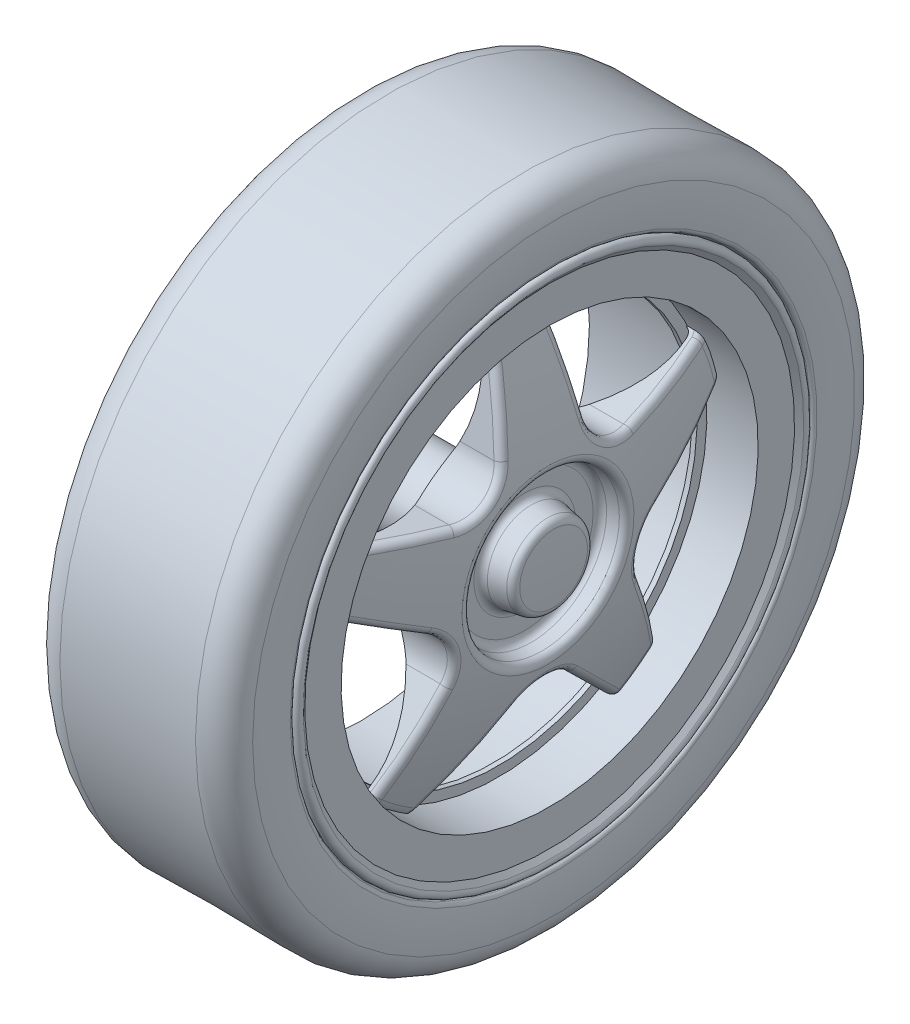
from build123d import *

# Parameters (mm, degrees)
CORTAR_EXTRUIR1_START = 28.999999999999996
CORTAR_EXTRUIR1_DEPTH = 28.999999999999996
MATRIZC1_COUNT        = 5
REDONDEO1_R           = 0.75
REDONDEO2_R           = 0.75
CORTAR_EXTRUIR2_DEPTH = 10


# Read off the part's stored shape, not the designer's step: Cortar-Revolución4
with BuildPart() as part:
    # Croquis1 → Revolución1 (revolve)
    with BuildSketch(Plane.XY):
        with BuildLine():
            Line((2.5, 24.999999999999996), (0.7352941176470583, 25.941176470588232))
            ThreePointArc((0.7352941176470585, 25.941176470588232), (0.12020814131487328, 25.825204772530324), (0.100301875811656, 25.199597920246344))
            Line((0.10030187581165524, 25.199597920246344), (0.5, 24.667782059947733))
            Line((0.5, 24.667782059947733), (0.5000000000000004, 20.999999999999996))
            Line((0.5000000000000004, 20.999999999999996), (13.83221794005226, 20.999999999999996))
            Line((13.83221794005226, 20.999999999999996), (15.83221794005226, 20.999999999999996))
            Line((15.83221794005226, 20.999999999999996), (19.5, 20.999999999999996))
            Line((19.5, 20.999999999999996), (19.5, 24.667782059947736))
            Line((19.5, 24.667782059947736), (19.899698124188344, 25.19959792024635))
            ThreePointArc((19.899698124188347, 25.19959792024635), (19.879791858685124, 25.825204772530324), (19.264705882352946, 25.941176470588236))
            Line((19.264705882352946, 25.941176470588236), (17.499999999999996, 25))
            Line((17.499999999999996, 25), (2.5, 24.999999999999996))
        make_face()
    revolve(axis=Axis((20, 0, 0), (-1, -1.2e-16, 0)))


with BuildPart() as body_2:
    # Croquis1<3> → Revolución2 (revolve)
    with BuildSketch(Plane.XY):
        with BuildLine():
            ThreePointArc((15.229709414249836, 20.044993192200682), (14.678536500553854, 20.73844454625571), (13.83221794005226, 20.999999999999996))
            Line((13.83221794005226, 20.999999999999996), (15.83221794005226, 20.999999999999996))
            ThreePointArc((15.83221794005226, 20.999999999999996), (16.01691722525036, 20.715355517227323), (16.161370397048206, 20.408321987001138))
            ThreePointArc((16.161370397048206, 20.408321987001138), (18.159269913999402, 14.261864726586808), (19.437899090853012, 7.926594664305913))
            Line((19.437899090853012, 7.926594664305913), (17.000000000000004, 7.5))
            Line((17.000000000000004, 7.5), (16.999999999999996, 4.500000000000001))
            Line((16.999999999999996, 4.500000000000001), (19.857395198343077, 4))
            ThreePointArc((19.857395198343077, 4), (19.96433747853814, 2.0012706044820376), (20, 0))
            Line((20, 0), (-4.999999999999995, -3.06e-15))
            Line((-4.999999999999995, -3.06e-15), (-4.999999999999994, 4))
            Line((-4.999999999999994, 4), (7.41803141324657, 6.172963582434665))
            ThreePointArc((7.41803141324657, 6.172963582434665), (14.609153979008614, 11.25895513363789), (15.229709414249836, 20.044993192200682))
        make_face()
    revolve(axis=Axis((20, 0, 0), (-1, -1.2e-16, 0)))

    # Croquis2 → Cortar-Extruir1 (cut)
    with BuildSketch(Plane(origin=(0, 0, 0), x_dir=(0, 0, -1), z_dir=(1, 0, 0)).offset(CORTAR_EXTRUIR1_START)):
        with BuildLine():
            ThreePointArc((-19.032482471529132, 8.874942871418174), (-12.343490298141932, 16.989356881873892), (-2.5592117207636766, 20.843474647196086))
            Line((-2.5592117207636766, 20.843474647196086), (-4.238740146298038, 10.618509398268122))
            ThreePointArc((-4.238740146298038, 10.618509398268122), (-5.834705949164168, 8.030783779695161), (-8.788959816618782, 7.312581296013566))
            Line((-8.788959816618782, 7.312581296013566), (-19.032482471529132, 8.874942871418174))
        make_face()
    cortar_extruir1 = extrude(amount=-CORTAR_EXTRUIR1_DEPTH, mode=Mode.SUBTRACT)

    # MatrizC1: Cortar-Extruir1 ×5 about axis
    matrizc1_axis = Axis((0, 1.5e-15, -3.8e-16), (1, 0, 0))
    for i in range(1, MATRIZC1_COUNT):
        add(cortar_extruir1.rotate(matrizc1_axis, i * 360 / MATRIZC1_COUNT), mode=Mode.SUBTRACT)


with BuildPart() as cortar_revoluci_n1_tool:
    # Croquis3 → Cortar-Revolución1 (revolve)
    with BuildSketch(Plane.XY):
        Polygon((14.332217940052262, 19.499999999999996), (14.332217940052264, 22.499999999999993), (14.332217940052264, 22.999999999999993), (13.83221794005226, 22.999999999999993), (13.83221794005226, 20.999999999999996), (13.83221794005226, 19.499999999999996), align=None)
        Polygon((13.83221794005226, 20.999999999999996), (13.83221794005226, 22.999999999999993), (-1.1677820599477382, 22.999999999999986), (-1.1677820599477386, 20.999999999999982), align=None)
    revolve(axis=Axis((7.418031413246568, -1.54e-15, 0), (-1, -1.2e-16, 0)))


with BuildPart() as part_1:
    add(part.part)

    # Cortar-Revolución1: cut by cortar_revoluci_n1_tool
    add(cortar_revoluci_n1_tool.part, mode=Mode.SUBTRACT)

    # Croquis4 → Revolución3 (revolve)
    with BuildSketch(Plane.XY):
        with BuildLine():
            Line((14.332217940052264, 22.999999999999993), (13.832217940052262, 22.999999999999993))
            Line((13.832217940052262, 22.999999999999993), (12.332217940052265, 22.999999999999996))
            ThreePointArc((12.332217940052265, 22.999999999999996), (13.392878111832086, 22.56066017177982), (13.832217940052262, 21.499999999999996))
            Line((13.832217940052262, 21.499999999999996), (13.832217940052262, 19.999999999999996))
            Line((13.832217940052262, 19.999999999999996), (14.332217940052264, 19.999999999999996))
            Line((14.332217940052264, 19.999999999999996), (14.332217940052264, 22.999999999999993))
        make_face()
    revolve(axis=Axis((7.418031413246568, -1.54e-15, 0), (-1, -1.2e-16, 0)))


with BuildPart() as body_2_1:
    add(body_2.part)

    # Cortar-Revolución1: cut by cortar_revoluci_n1_tool
    add(cortar_revoluci_n1_tool.part, mode=Mode.SUBTRACT)

    # Redondeo1
    redondeo1_edges = [body_2_1.edges().sort_by_distance(p)[0] for p in [
        (16.017390352561375, -18.157716094822753, -9.969355513847564),
        (17.713468801645313, -14.549912860999985, -6.320010510851247),
        (19.115914274162588, -9.926594664307888, -2.471356e-11),
        (16.017390352561375, -18.157716094822757, 9.969355513847558),
        (17.713468801645313, -14.549912860999985, 6.320010510851239),
        (17.000000000000004, -7.5, -4.25e-15),
        (16.01739035256137, -15.09246337704348, 14.188313936274088),
        (17.713468801645327, -10.506857520122566, 11.884798785499381),
        (19.11591427416263, -3.067486447566317, 9.44075254010308),
        (16.017390352561375, 3.870377672372002, 20.349714489763052),
        (17.713468801645355, 1.514516838675414, 15.79078009046219),
        (16.999999999999996, -4.500000000000001, -5.5e-16),
        (19.857395198343077, -4, -4.9e-16),
        (19.11591427416269, 8.030783779682231, 5.834705949185325),
        (16.01739035256137, 20.54974104564736, 2.607459702182234),
        (17.713468801645412, 15.485935743835702, 3.4392282939293777),
        (16.01739035256137, 8.830060753846865, 18.738215769518757),
        (17.71346880164539, 8.056317798611854, 13.665220109743553),
        (16.01739035256137, 20.54974104564736, -2.607459702182232),
        (17.713468801645405, 15.485935743835707, -3.439228293929376),
        (19.11591427416269, 8.030783779711285, -5.834705949145338),
        (16.01739035256137, 8.830060753846867, -18.738215769518757),
        (17.71346880164539, 8.056317798611854, -13.665220109743546),
        (16.01739035256137, 3.870377672372008, -20.349714489763052),
        (17.713468801645355, 1.5145168386754158, -15.790780090462187),
        (19.115914274162627, -3.0674864475193098, -9.440752540118355),
        (16.017390352561375, -15.092463377043474, -14.18831393627409),
        (17.713468801645327, -10.506857520122566, -11.884798785499385),
    ]]
    fillet(redondeo1_edges, radius=REDONDEO1_R)

    # Cortar-Revolución4 outline → Cortar-Revolución4 (revolve, cut)
    with BuildSketch(Plane.YX):
        Polygon((4, -5), (6.172963582, 7.418031413), (10.776802277, 7.418031413), (10.776802277, 14.320012605), (4, 10), align=None)
    revolve(axis=Axis((0, 0, 0), (1, 0, 0)), mode=Mode.SUBTRACT)

    # Redondeo2
    redondeo2_edges = [body_2_1.edges().sort_by_distance(p)[0] for p in [
        (19.437899090853016, -7.926594664305911, -9.7e-16),
    ]]
    fillet(redondeo2_edges, radius=REDONDEO2_R)

    # Croquis8 → Cortar-Extruir2 (cut)
    with BuildSketch(Plane.ZY.offset(4.999999999999994)):
        with BuildLine():
            Line((-1.7999999999999998, 2.012461179749811), (-1.7999999999999998, -2.012461179749811))
            ThreePointArc((-1.7999999999999998, -2.012461179749811), (3.8e-16, -2.6999999999999966), (1.8000000000000003, -2.012461179749811))
            Line((1.8000000000000003, -2.012461179749811), (1.8000000000000003, 2.012461179749811))
            ThreePointArc((1.8000000000000003, 2.012461179749811), (3.8e-16, 2.6999999999999993), (-1.7999999999999998, 2.012461179749811))
        make_face()
    extrude(amount=-CORTAR_EXTRUIR2_DEPTH, mode=Mode.SUBTRACT)


with BuildPart() as body_3:
    # Croquis7<4> → Revolve2 (revolve)
    with BuildSketch(Plane.XY, mode=Mode.PRIVATE) as revolve2_sk:
        with BuildLine():
            Line((19.63807526131374, 26.14030680603399), (17.499999999999996, 25))
            Line((17.499999999999996, 25), (2.5, 24.999999999999996))
            Line((2.5, 24.999999999999996), (0.36192473868625213, 26.140306806033994))
            ThreePointArc((0.36192473868625213, 26.140306806033994), (0.18263537681055253, 26.30198276051036), (0.1, 26.528820112013626))
            ThreePointArc((0.1, 26.528820112013626), (7.11e-15, 28.422399549832626), (0.1, 30.315978987651633))
            ThreePointArc((0.1, 30.315978987651633), (1.1092664497680278, 32.259012986390495), (3.170041743989857, 32.998746096104654))
            ThreePointArc((3.170041743989857, 32.998746096104654), (10.000000000000023, 32.89999999999998), (16.829958256010144, 32.998746096104654))
            ThreePointArc((16.829958256010144, 32.998746096104654), (18.89073355023197, 32.25901298639051), (19.900000000000006, 30.31597898765165))
            ThreePointArc((19.900000000000006, 30.31597898765165), (20.00000000000001, 28.42239954983263), (19.89999999999999, 26.528820112013612))
            ThreePointArc((19.89999999999999, 26.528820112013612), (19.817364623189437, 26.301982760510352), (19.63807526131374, 26.14030680603399))
        make_face()
    revolve(revolve2_sk.sketch.rotate(Axis((0, 0, 0), (1, 0, 0)), 90), axis=Axis((0, 0, 0), (1, 0, 0)))


solid = Compound([part_1.part, body_2_1.part, body_3.part])
